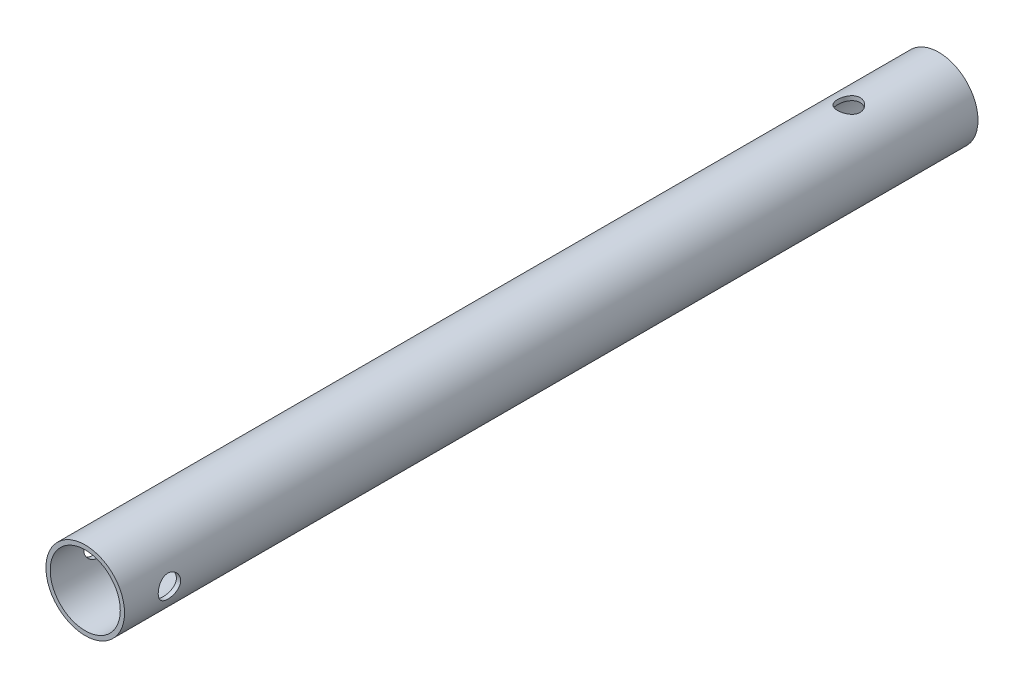
from build123d import *

# Parameters (mm, degrees)
SKETCH3_R           = 22.225
SKETCH3_R_2         = 19.812
BOSS_EXTRUDE1_DEPTH = 241.3
SKETCH4_R           = 6.35
CUT_EXTRUDE1_DEPTH  = 247.364451829
SKETCH5_R           = 6.35
CUT_EXTRUDE2_DEPTH  = 247.364451954


with BuildPart() as part:
    # Sketch3 → Boss-Extrude1 (new, symmetric)
    with BuildSketch(Plane.XY):
        Circle(SKETCH3_R)
        Circle(SKETCH3_R_2, mode=Mode.SUBTRACT)
    extrude(amount=BOSS_EXTRUDE1_DEPTH, both=True)

    # Sketch4 → Cut-Extrude1 (cut, through all)
    with BuildSketch(Plane(origin=(0, 22.225, 0), x_dir=(1, 0, 0), z_dir=(0, 1, 0))):
        with Locations((0, 190.5)):
            Circle(SKETCH4_R)
    extrude(amount=-CUT_EXTRUDE1_DEPTH, mode=Mode.SUBTRACT)

    # Sketch5 → Cut-Extrude2 (cut, through all)
    with BuildSketch(Plane(origin=(22.225, 0, 0), x_dir=(0, 0, -1), z_dir=(1, 0, 0))):
        with Locations((-215.9, 0)):
            Circle(SKETCH5_R)
    extrude(amount=-CUT_EXTRUDE2_DEPTH, mode=Mode.SUBTRACT)


solid = part.part
